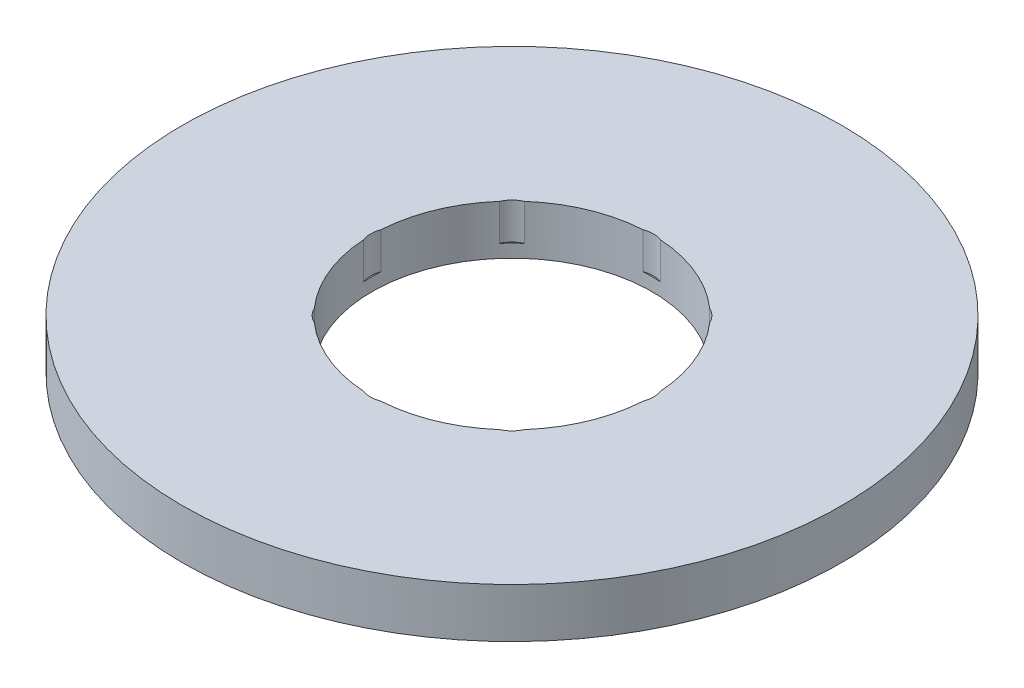
from build123d import *

# Parameters (mm, degrees)
SKETCH1_R           = 100
BOSS_EXTRUDE1_DEPTH = 15
SKETCH2_R           = 42.5
CUT_EXTRUDE1_DEPTH  = 143.214626533
SKETCH3_R           = 7.700910662
CUT_EXTRUDE2_DEPTH  = 11.044050769
CIRPATTERN1_COUNT   = 8


with BuildPart() as part:
    # Sketch1 → Boss-Extrude1 (new body)
    with BuildSketch(Plane(origin=(0, 0, 0), x_dir=(1, 0, 0), z_dir=(0, 1, 0))):
        Circle(SKETCH1_R)
    extrude(amount=BOSS_EXTRUDE1_DEPTH)

    # Sketch2 → Cut-Extrude1 (cut, through all)
    with BuildSketch(Plane(origin=(0, 0, 0), x_dir=(1, 0, 0), z_dir=(0, 1, 0))):
        Circle(SKETCH2_R)
    extrude(amount=CUT_EXTRUDE1_DEPTH, mode=Mode.SUBTRACT)

    # Sketch3 → Cut-Extrude2 (cut)
    with BuildSketch(Plane(origin=(0, 15, 0), x_dir=(1, 0, 0), z_dir=(0, 1, 0))):
        with Locations((-35.194980045, 0)):
            Circle(SKETCH3_R)
    cut_extrude2 = extrude(amount=-CUT_EXTRUDE2_DEPTH, mode=Mode.SUBTRACT)

    # CirPattern1: Cut-Extrude2 ×8 about axis
    cirpattern1_axis = Axis((0, 0, 0), (0, 1, 0))
    for i in range(1, CIRPATTERN1_COUNT):
        add(cut_extrude2.rotate(cirpattern1_axis, i * 360 / CIRPATTERN1_COUNT), mode=Mode.SUBTRACT)


solid = part.part
